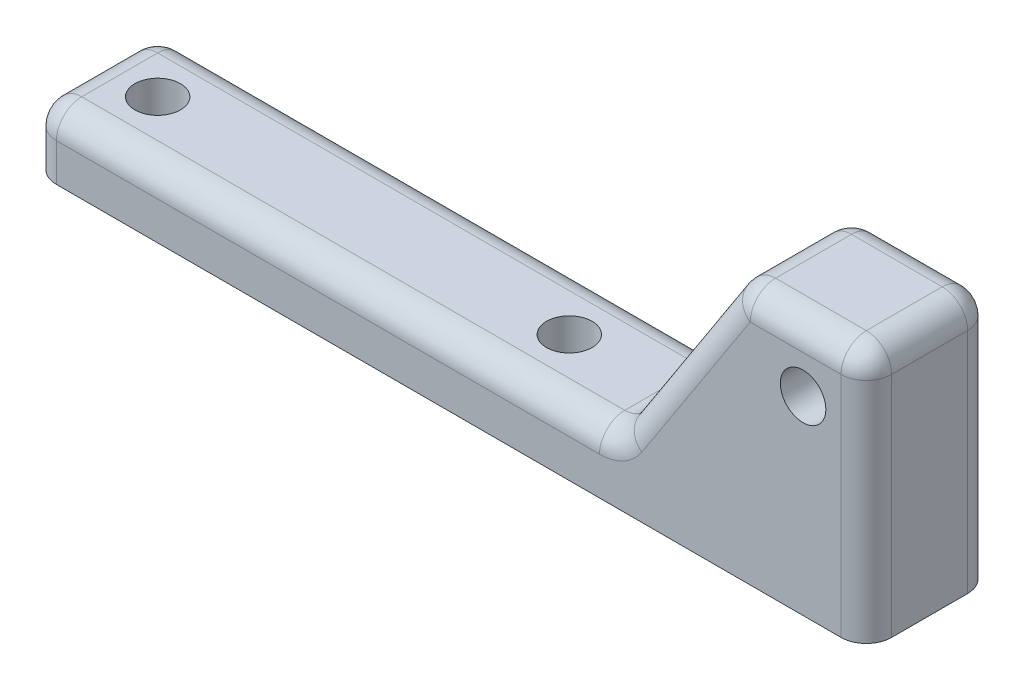
from build123d import *

# Parameters (mm, degrees)
SKETCH1_W           = 83.82
SKETCH1_H           = 12.7
SKETCH1_R           = 2.286
BOSS_EXTRUDE1_DEPTH = 25.4
SKETCH2_R           = 2.286
CUT_EXTRUDE1_DEPTH  = 12.7
FILLET1_R           = 2.54
SKETCH3_W           = 71.12
SKETCH3_H           = 19.05
CUT_EXTRUDE2_DEPTH  = 89.499957062
CHAMFER1_SIZE       = 19.55628504
CHAMFER1_SIZE_2     = 12.7
FILLET2_R           = 2.54


with BuildPart() as part:
    # Sketch1 → Boss-Extrude1 (new body)
    with BuildSketch(Plane(origin=(0, 0, 0), x_dir=(1, 0, 0), z_dir=(0, 1, 0))):
        with Locations((41.91, 6.35)):
            Rectangle(SKETCH1_W, SKETCH1_H)
        with Locations(Location((6.35, 6.35, 0), (0, 0, 90))):
            Circle(SKETCH1_R, mode=Mode.SUBTRACT)
        with Locations(Location((47.659178157, 6.35, 0), (0, 0, 90))):
            Circle(SKETCH1_R, mode=Mode.SUBTRACT)
    extrude(amount=BOSS_EXTRUDE1_DEPTH)

    # Sketch2 → Cut-Extrude1 (cut)
    with BuildSketch(Plane.XY):
        with Locations((77.47, 19.05)):
            Circle(SKETCH2_R)
    extrude(amount=-CUT_EXTRUDE1_DEPTH, mode=Mode.SUBTRACT)

    # Fillet1
    fillet1_edges = [part.edges().sort_by_distance(p)[0] for p in [
        (0, 12.7, -12.7),
        (83.82, 12.7, -12.7),
        (83.82, 12.7, 0),
        (0, 12.7, 0),
    ]]
    fillet(fillet1_edges, radius=FILLET1_R)

    # Sketch3 → Cut-Extrude2 (cut, through all)
    with BuildSketch(Plane.XY):
        with Locations((35.56, 15.875)):
            Rectangle(SKETCH3_W, SKETCH3_H)
    extrude(amount=-CUT_EXTRUDE2_DEPTH, mode=Mode.SUBTRACT)

    # Chamfer1
    # the kernel refuses this chamfer: 19.55628504, 12.7 mm, written as the material it adds along each edge
    with BuildSketch(Plane(origin=(71.12, 6.35, 0), x_dir=(0.021073765466273545, 0.9997779235455604, 0), z_dir=(0, 0, -1))) as chamfer1_piece_1_section:
        Polygon((CHAMFER1_SIZE * 0.999777923568, -CHAMFER1_SIZE * 0.0210737654668), (-CHAMFER1_SIZE_2 * 0.0210737654663, -CHAMFER1_SIZE_2 * 0.999777923546), (0, 0), align=None)
    chamfer1_piece_1 = extrude(amount=12.7, mode=Mode.PRIVATE)
    chamfer1_piece_1 = split(chamfer1_piece_1, bisect_by=Plane(origin=(66.98884067, 25.4, -6.35), z_dir=(0, -1, 0)), keep=Keep.TOP, mode=Mode.PRIVATE)
    add(chamfer1_piece_1)

    # Fillet2
    fillet2_edges = [part.edges().sort_by_distance(p)[0] for p in [
        (76.035607325, 25.4, -12.7),
        (83.82, 25.4, -6.35),
        (83.076051224, 25.4, -0.743948776),
        (83.076051224, 25.4, -11.956051224),
        (0.743948776, 6.35, -0.743948776),
        (76.035607325, 25.4, 0),
        (0, 6.35, -6.35),
        (0.743948776, 6.35, -11.956051224),
        (30.48, 6.35, -12.7),
        (30.48, 6.35, 0),
        (58.42, 6.35, -6.35),
        (70.79121465, 25.4, -6.35),
        (64.605607325, 15.875, 0),
        (64.605607325, 15.875, -12.7),
    ]]
    fillet(fillet2_edges, radius=FILLET2_R)


solid = part.part
